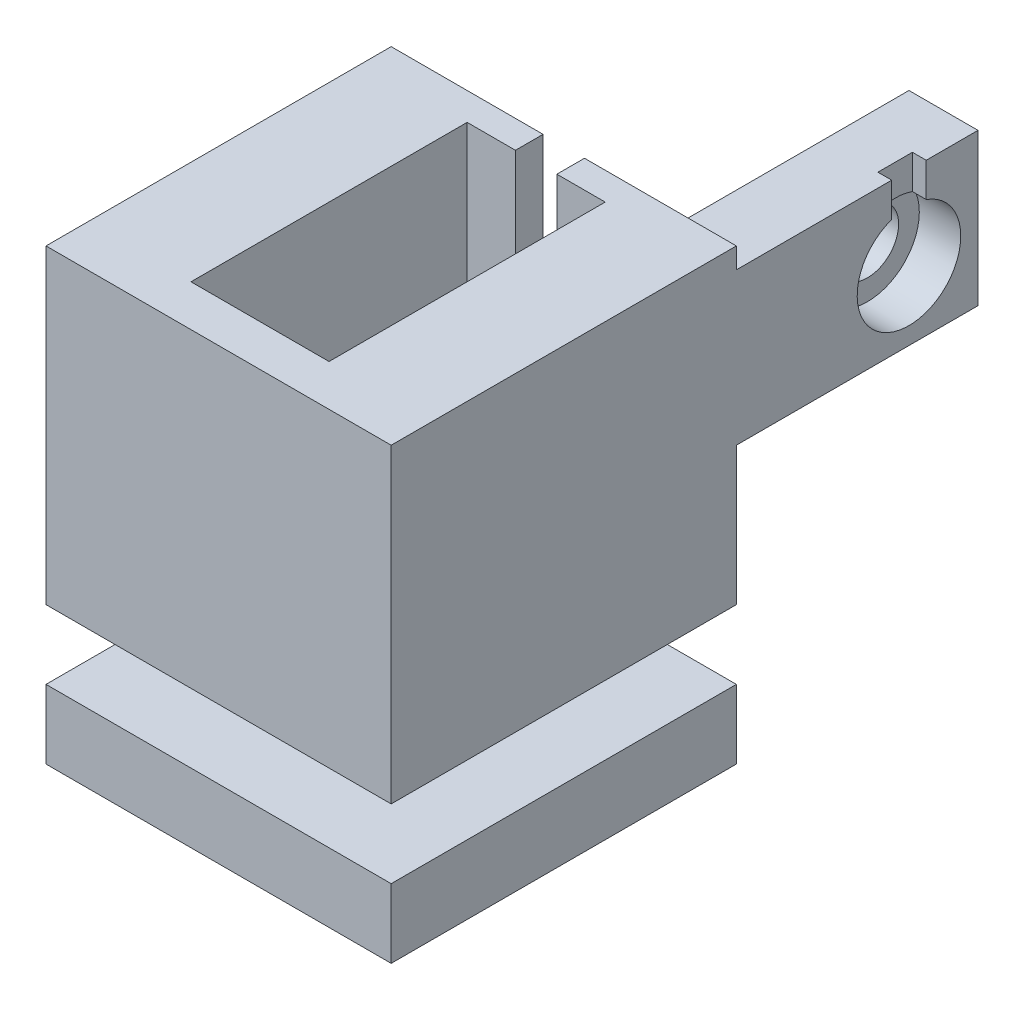
from build123d import *

# Parameters (mm, degrees)
CROQUIS1_W              = 50
CROQUIS1_H              = 50
SALIENTE_EXTRUIR1_DEPTH = 40
CROQUIS2_W              = 50
CROQUIS2_H              = 50
CROQUIS2_W_2            = 20
CROQUIS2_H_2            = 40
SALIENTE_EXTRUIR2_DEPTH = 25
CROQUIS3_R              = 4
CORTAR_EXTRUIR1_DEPTH   = 54.38539126
CROQUIS4_R              = 6
CORTAR_EXTRUIR2_DEPTH   = 25
CORTAR_EXTRUIR3_REACH   = 87.732
CROQUIS5_W              = 6
CROQUIS5_H              = 20
CROQUIS6_W              = 10
CROQUIS6_H              = 22
SALIENTE_EXTRUIR3_DEPTH = 35
CROQUIS7_R              = 7.5
CORTAR_EXTRUIR4_DEPTH   = 6
CROQUIS8_R              = 4.5
CORTAR_EXTRUIR5_DEPTH   = 8
CROQUIS10_W             = 50
CROQUIS10_H             = 10
CORTAR_EXTRUIR6_DEPTH   = 10
MATRIZC2_COUNT          = 4
CROQUIS11_W             = 5
CROQUIS11_H             = 10
CORTAR_EXTRUIR7_DEPTH   = 2
CROQUIS13_R             = 2
CORTAR_EXTRUIR8_DEPTH   = 10


with BuildPart() as part:
    # Croquis1 → Saliente-Extruir1 (new body)
    with BuildSketch(Plane(origin=(0, 0, 0), x_dir=(1, 0, 0), z_dir=(0, 1, 0))):
        Rectangle(CROQUIS1_W, CROQUIS1_H)
    extrude(amount=SALIENTE_EXTRUIR1_DEPTH)

    # Croquis2 → Saliente-Extruir2 (add)
    with BuildSketch(Plane(origin=(0, 40, 0), x_dir=(1, 0, 0), z_dir=(0, 1, 0))):
        Rectangle(CROQUIS2_W, CROQUIS2_H)
        with Locations((0, 1)):
            Rectangle(CROQUIS2_W_2, CROQUIS2_H_2, mode=Mode.SUBTRACT)
    extrude(amount=SALIENTE_EXTRUIR2_DEPTH)

    # Croquis3 → Cortar-Extruir1 (cut, through all)
    with BuildSketch(Plane(origin=(0, 40, 0), x_dir=(1, 0, 0), z_dir=(0, 1, 0))):
        Circle(CROQUIS3_R)
    extrude(amount=-CORTAR_EXTRUIR1_DEPTH, mode=Mode.SUBTRACT)

    # Croquis4 → Cortar-Extruir2 (cut)
    with BuildSketch(Plane(origin=(0, 40, 0), x_dir=(1, 0, 0), z_dir=(0, 1, 0))):
        Circle(CROQUIS4_R)
    extrude(amount=-CORTAR_EXTRUIR2_DEPTH, mode=Mode.SUBTRACT)

    # Croquis5 → Cortar-Extruir3 (cut, up to next)
    with BuildSketch(Plane(origin=(0, 0, -25), x_dir=(-1, 0, 0), z_dir=(0, 0, -1)), mode=Mode.PRIVATE) as cortar_extruir3_sk1:
        with Locations((0, 55)):
            Rectangle(CROQUIS5_W, CROQUIS5_H)
    cortar_extruir3_tool1 = extrude(cortar_extruir3_sk1.sketch, amount=-CORTAR_EXTRUIR3_REACH, mode=Mode.PRIVATE) & part.part
    add(cortar_extruir3_tool1.solids().sort_by_distance((0, 55, -25))[0], mode=Mode.SUBTRACT)

    # Croquis6 → Saliente-Extruir3 (add)
    with BuildSketch(Plane(origin=(0, 0, -25), x_dir=(-1, 0, 0), z_dir=(0, 0, -1))):
        with Locations((-20, 51)):
            Rectangle(CROQUIS6_W, CROQUIS6_H)
    extrude(amount=SALIENTE_EXTRUIR3_DEPTH)

    # Croquis7 → Cortar-Extruir4 (cut)
    with BuildSketch(Plane(origin=(25, 0, 0), x_dir=(0, 0, -1), z_dir=(1, 0, 0))):
        with Locations((50, 50)):
            Circle(CROQUIS7_R)
    extrude(amount=-CORTAR_EXTRUIR4_DEPTH, mode=Mode.SUBTRACT)

    # Croquis8 → Cortar-Extruir5 (cut)
    with BuildSketch(Plane(origin=(19, 0, 0), x_dir=(0, 0, -1), z_dir=(1, 0, 0))):
        with Locations((50, 50)):
            Circle(CROQUIS8_R)
    extrude(amount=-CORTAR_EXTRUIR5_DEPTH, mode=Mode.SUBTRACT)

    # Croquis10 → Cortar-Extruir6 (cut)
    with BuildSketch(Plane(origin=(25, 0, 0), x_dir=(0, 0, -1), z_dir=(1, 0, 0))):
        with Locations((0, 15)):
            Rectangle(CROQUIS10_W, CROQUIS10_H)
    cortar_extruir6 = extrude(amount=-CORTAR_EXTRUIR6_DEPTH, mode=Mode.SUBTRACT)

    # MatrizC2: Cortar-Extruir6 ×4 about axis
    matrizc2_axis = Axis((0, 15, 0), (0, 1, 0))
    for i in range(1, MATRIZC2_COUNT):
        add(cortar_extruir6.rotate(matrizc2_axis, i * 360 / MATRIZC2_COUNT), mode=Mode.SUBTRACT)

    # Croquis11 → Cortar-Extruir7 (cut)
    with BuildSketch(Plane(origin=(25, 0, 0), x_dir=(0, 0, -1), z_dir=(1, 0, 0))):
        with Locations((50, 60)):
            Rectangle(CROQUIS11_W, CROQUIS11_H)
    extrude(amount=-CORTAR_EXTRUIR7_DEPTH, mode=Mode.SUBTRACT)

    # Croquis13 → Cortar-Extruir8 (cut)
    with BuildSketch(Plane(origin=(0, 0, -25), x_dir=(-1, 0, 0), z_dir=(0, 0, -1))):
        with Locations((20, 50)):
            Circle(CROQUIS13_R)
    extrude(amount=-CORTAR_EXTRUIR8_DEPTH, mode=Mode.SUBTRACT)


solid = part.part
